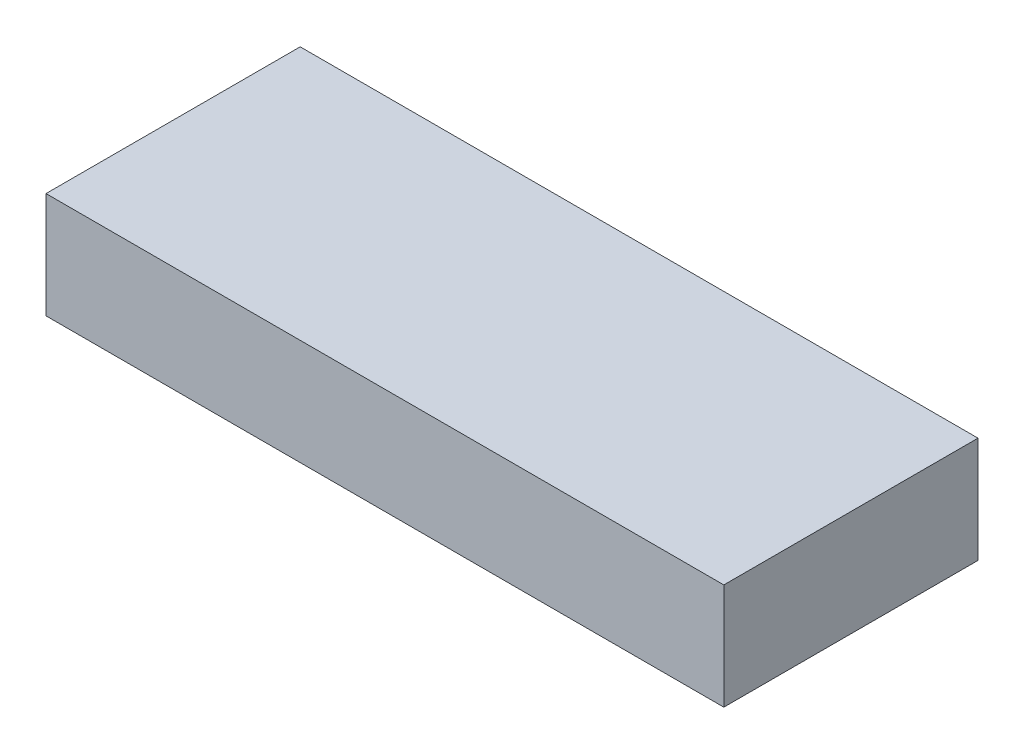
from build123d import *

# Parameters (mm, degrees)
SKETCH_PARENT_STRUCTURE_W = 96
SKETCH_PARENT_STRUCTURE_H = 36
PARENT_STRUCTURE_DEPTH    = 15


with BuildPart() as part:
    # Sketch: Parent Structure → Parent Structure (new body)
    with BuildSketch(Plane(origin=(0, 0, 0), x_dir=(1, 0, 0), z_dir=(0, 1, 0))):
        with Locations((48, 0)):
            Rectangle(SKETCH_PARENT_STRUCTURE_W, SKETCH_PARENT_STRUCTURE_H)
    extrude(amount=-PARENT_STRUCTURE_DEPTH)


solid = part.part
